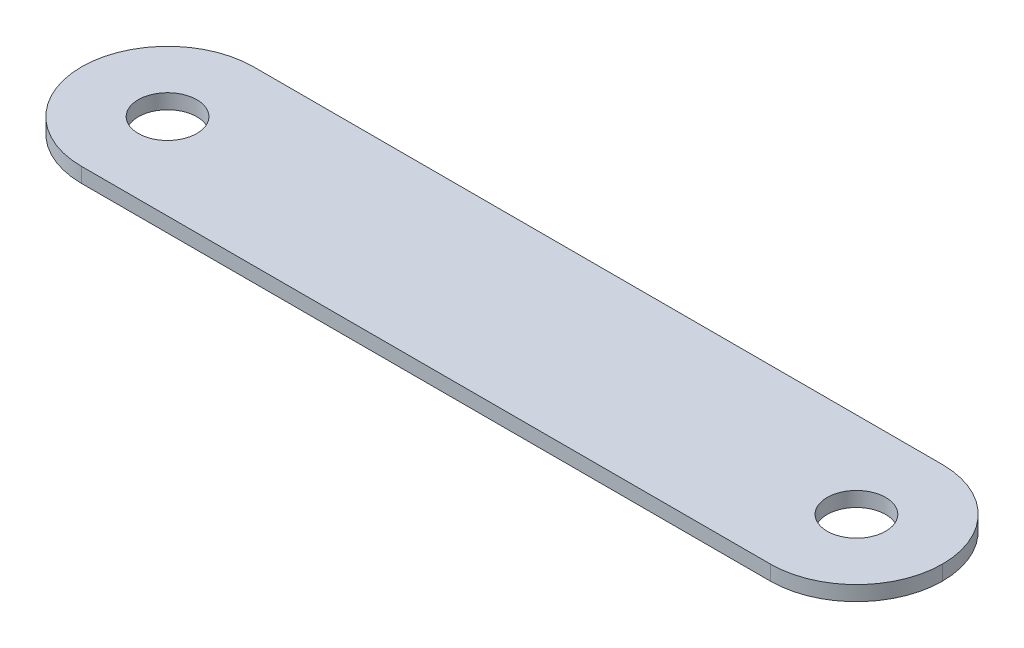
from build123d import *

# Parameters (mm, degrees)
SKETCH1_W                = 50
SKETCH1_H                = 10
BASE_FLANGE1_DEPTH       = 0.86
M3_CLEARANCE_HOLE1_D     = 3.4
M3_CLEARANCE_HOLE1_DEPTH = 1.29
M3_CLEARANCE_HOLE1_TIP   = 1.021463052
FILLET1_R                = 5


# Sheet-metal steps are written as plain solids
with BuildPart() as part:
    # Sketch1 → Base-Flange1 (new body)
    with BuildSketch(Plane(origin=(0, 0, 0), x_dir=(1, 0, 0), z_dir=(0, 1, 0))):
        Rectangle(SKETCH1_W, SKETCH1_H)
    extrude(amount=-BASE_FLANGE1_DEPTH)

    # M3 Clearance Hole1
    with Locations(Plane(origin=(0, 0, 0), x_dir=(1, 0, 0), z_dir=(0, 1, 0))):
        with Locations((-20, 0), (20, 0)):
            Hole(M3_CLEARANCE_HOLE1_D / 2, depth=M3_CLEARANCE_HOLE1_DEPTH)
            with Locations((0, 0, -(M3_CLEARANCE_HOLE1_DEPTH + M3_CLEARANCE_HOLE1_TIP / 2))):  # 118° drill point
                Cone(0, M3_CLEARANCE_HOLE1_D / 2, M3_CLEARANCE_HOLE1_TIP, mode=Mode.SUBTRACT)

    # Fillet1
    fillet1_edges = [part.edges().sort_by_distance(p)[0] for p in [
        (25, -0.43, 5),
        (25, -0.43, -5),
        (-25, -0.43, -5),
        (-25, -0.43, 5),
    ]]
    fillet(fillet1_edges, radius=FILLET1_R - 0.0001)  # a hair under: the kernel refuses the full size


solid = part.part
